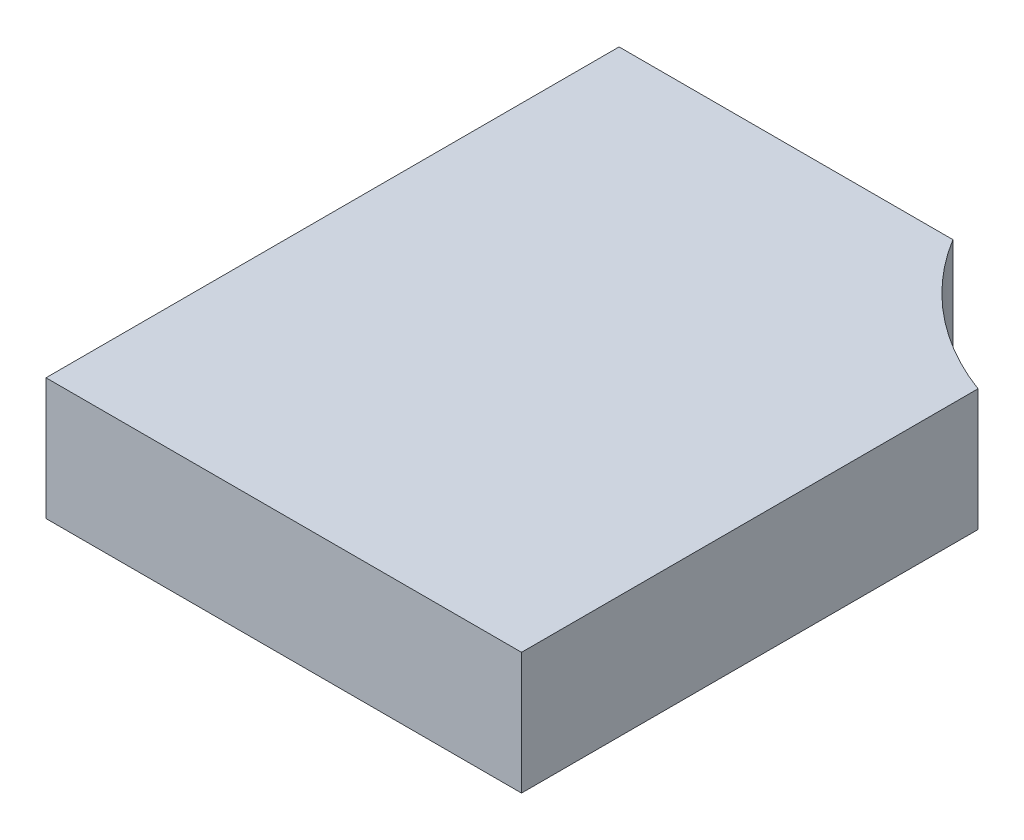
from build123d import *

# Parameters (mm, degrees)
EXTRUDE_1_DEPTH = 10


with BuildPart() as part:
    # ｽｹｯﾁ1 → ﾎﾞｽ - 押し出し1 (new body)
    with BuildSketch(Plane(origin=(0, 0, 0), x_dir=(1, 0, 0), z_dir=(0, 1, 0))):
        with BuildLine():
            Line((27.37858313, 0), (0, 0))
            Line((0, 0), (0, -47))
            Line((0, -47), (39, -47))
            Line((39, -47), (39, -9.563858653))
            ThreePointArc((39, -9.563858653), (32.384853214, -5.759433674), (27.37858313, 0))
        make_face()
    extrude(amount=-EXTRUDE_1_DEPTH)


solid = part.part
